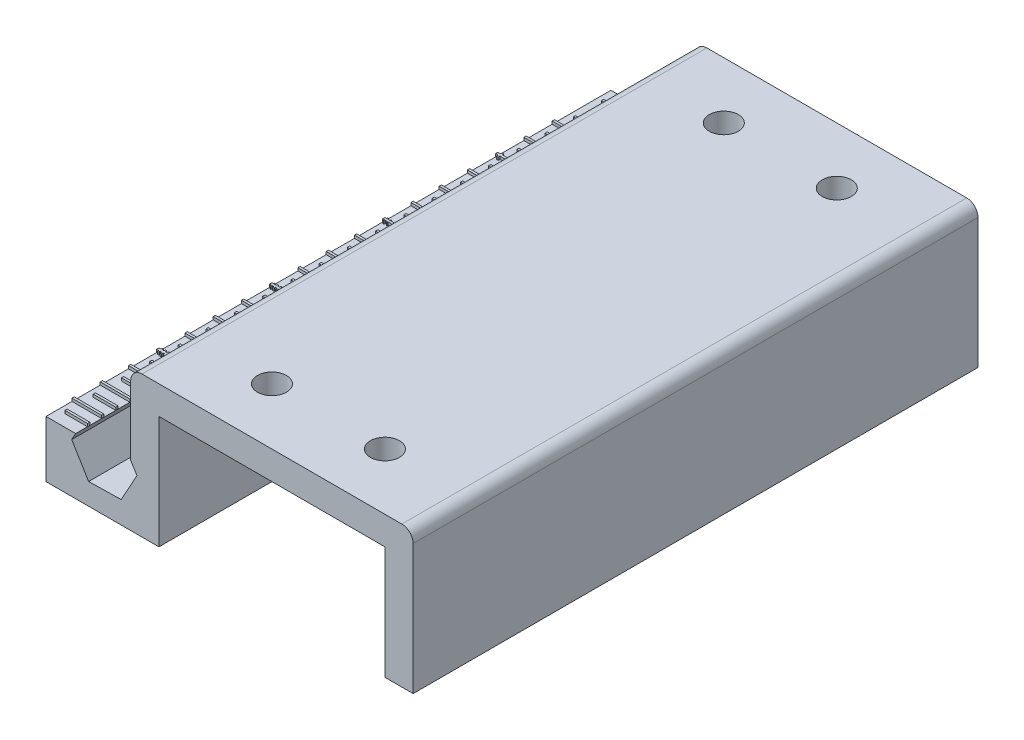
from build123d import *

# Parameters (mm, degrees)
BOSS_EXTRUDE2_DEPTH = 127
THE_RULER_W         = 6.669403244
THE_RULER_H         = 0.508
THE_RULER_W_2       = 5.08
BOSS_EXTRUDE6_DEPTH = 13.335
CUT_EXTRUDE1_DEPTH  = 127
SKETCH10_R          = 3.2639
CUT_EXTRUDE2_DEPTH  = 143.839717866


with BuildPart() as part:
    # Sketch1 → Boss-Extrude2 (new body)
    with BuildSketch(Plane.XY):
        with BuildLine():
            Line((50.8, 0), (57.15, 0))
            Line((57.15, 0), (57.15, 29.21))
            ThreePointArc((57.15, 29.21), (56.406051224, 31.006051224), (54.61, 31.75))
            Line((54.61, 31.75), (-3.81, 31.75))
            ThreePointArc((-3.81, 31.75), (-5.606051224, 31.006051224), (-6.35, 29.21))
            Line((-6.35, 29.21), (-6.35, 13.696358937))
            Line((-6.35, 13.696358937), (-4.955326016, 11.392114963))
            Line((-4.955326016, 11.392114963), (-8.489396689, 4.967655623))
            Line((-8.489396689, 4.967655623), (-15.820177019, 4.816020934))
            Line((-15.820177019, 4.816020934), (-19.616886677, 11.088845586))
            Line((-19.616886677, 11.088845586), (-18.730596756, 12.7))
            Line((-18.730596756, 12.7), (-25.4, 12.7))
            Line((-25.4, 12.7), (-25.4, 0))
            Line((-25.4, 0), (0, 0))
            Line((0, 0), (0, 25.4))
            Line((0, 25.4), (50.8, 25.4))
            Line((50.8, 25.4), (50.8, 0))
        make_face()
    extrude(amount=BOSS_EXTRUDE2_DEPTH)

    # THE RULER → Boss-Extrude6 (add)
    with BuildSketch(Plane(origin=(0, 0, 0), x_dir=(1, 0, 0), z_dir=(0, 1, 0))):
        with Locations((-22.065298378, -12.954)):
            Rectangle(THE_RULER_W, THE_RULER_H)
        with Locations((-22.065298378, -19.304)):
            Rectangle(THE_RULER_W, THE_RULER_H)
        Polygon((-18.730596756, -25.4), (-24.423685308, -25.4), (-24.423685308, -25.062958071), (-24.805558384, -25.062958071), (-24.805558384, -25.4), (-25.4, -25.4), (-25.4, -25.908), (-24.805558384, -25.908), (-24.805558384, -26.314653152), (-24.423685308, -26.314653152), (-24.423685308, -25.908), (-18.730596756, -25.908), align=None)
        with Locations((-22.065298378, -32.004)):
            Rectangle(THE_RULER_W, THE_RULER_H)
        Polygon((-24.29736963, -50.8), (-24.805558384, -50.8), (-24.805558384, -50.547467514), (-25.034254998, -50.547467514), (-25.034254998, -50.8), (-25.4, -50.8), (-25.4, -51.308), (-25.034254998, -51.308), (-25.034254998, -51.584005443), (-24.805558384, -51.584005443), (-24.805558384, -51.308), (-24.29736963, -51.308), (-24.29736963, -51.584005443), (-24.153376967, -51.584005443), (-24.153376967, -51.308), (-18.730596756, -51.308), (-18.730596756, -50.8), (-24.153376967, -50.8), (-24.153376967, -50.531005937), (-24.29736963, -50.531005937), align=None)
        with Locations((-22.065298378, -38.354)):
            Rectangle(THE_RULER_W, THE_RULER_H)
        with Locations((-22.065298378, -44.704)):
            Rectangle(THE_RULER_W, THE_RULER_H)
        Polygon((-24.423685308, -76.2), (-24.805558384, -76.2), (-24.805558384, -75.975694542), (-25.034254998, -75.975694542), (-25.034254998, -76.2), (-25.4, -76.2), (-25.4, -76.708), (-25.034254998, -76.708), (-25.034254998, -76.994970777), (-24.805558384, -76.994970777), (-24.805558384, -76.708), (-24.423685308, -76.708), (-24.423685308, -76.994970777), (-24.153376967, -76.994970777), (-24.153376967, -76.708), (-23.70340887, -76.708), (-23.70340887, -76.994970777), (-23.426490036, -76.994970777), (-23.426490036, -76.708), (-18.730596756, -76.708), (-18.730596756, -76.2), (-23.426490036, -76.2), (-23.426490036, -75.918827503), (-23.70340887, -75.918827503), (-23.70340887, -76.2), (-24.153376967, -76.2), (-24.153376967, -75.955015619), (-24.423685308, -75.955015619), align=None)
        with Locations((-22.065298378, -57.404)):
            Rectangle(THE_RULER_W, THE_RULER_H)
        with Locations((-22.065298378, -63.754)):
            Rectangle(THE_RULER_W, THE_RULER_H)
        with Locations((-22.065298378, -70.104)):
            Rectangle(THE_RULER_W, THE_RULER_H)
        Polygon((-18.730596756, -101.6), (-22.46829669, -101.6), (-22.46829669, -101.264555756), (-22.801754068, -101.264555756), (-22.801754068, -101.6), (-23.208268705, -101.6), (-23.208268705, -101.247593904), (-23.588496513, -101.247593904), (-23.588496513, -101.6), (-23.986830406, -101.6), (-23.986830406, -101.281517608), (-24.29736963, -101.281517608), (-24.29736963, -101.6), (-24.647702548, -101.6), (-24.647702548, -101.281517608), (-24.937399925, -101.281517608), (-24.937399925, -101.6), (-25.4, -101.6), (-25.4, -102.108), (-24.937399925, -102.108), (-24.937399925, -102.393984646), (-24.647702548, -102.393984646), (-24.647702548, -102.108), (-24.29736963, -102.108), (-24.29736963, -102.475462033), (-23.986830406, -102.475462033), (-23.986830406, -102.108), (-23.588496513, -102.108), (-23.588496513, -102.475462033), (-23.208268705, -102.475462033), (-23.208268705, -102.108), (-22.801754068, -102.108), (-22.801754068, -102.475462033), (-22.46829669, -102.475462033), (-22.46829669, -102.108), (-18.730596756, -102.108), align=None)
        with Locations((-22.065298378, -82.804)):
            Rectangle(THE_RULER_W, THE_RULER_H)
        with Locations((-22.065298378, -89.154)):
            Rectangle(THE_RULER_W, THE_RULER_H)
        with Locations((-22.065298378, -95.504)):
            Rectangle(THE_RULER_W, THE_RULER_H)
        with Locations((-22.065298378, -108.204)):
            Rectangle(THE_RULER_W, THE_RULER_H)
        with Locations((-22.065298378, -114.554)):
            Rectangle(THE_RULER_W, THE_RULER_H)
        with Locations((-22.065298378, -120.904)):
            Rectangle(THE_RULER_W, THE_RULER_H)
        with Locations((-21.270596756, -47.879)):
            Rectangle(THE_RULER_W_2, THE_RULER_H)
        with Locations((-21.270596756, -3.429)):
            Rectangle(THE_RULER_W_2, THE_RULER_H)
        with Locations((-21.270596756, -9.779)):
            Rectangle(THE_RULER_W_2, THE_RULER_H)
        with Locations((-21.270596756, -16.129)):
            Rectangle(THE_RULER_W_2, THE_RULER_H)
        with Locations((-21.270596756, -22.479)):
            Rectangle(THE_RULER_W_2, THE_RULER_H)
        with Locations((-21.270596756, -28.829)):
            Rectangle(THE_RULER_W_2, THE_RULER_H)
        with Locations((-21.270596756, -35.179)):
            Rectangle(THE_RULER_W_2, THE_RULER_H)
        with Locations((-21.270596756, -41.529)):
            Rectangle(THE_RULER_W_2, THE_RULER_H)
        with Locations((-21.270596756, -54.229)):
            Rectangle(THE_RULER_W_2, THE_RULER_H)
        with Locations((-21.270596756, -60.579)):
            Rectangle(THE_RULER_W_2, THE_RULER_H)
        with Locations((-21.270596756, -66.929)):
            Rectangle(THE_RULER_W_2, THE_RULER_H)
        with Locations((-21.270596756, -73.279)):
            Rectangle(THE_RULER_W_2, THE_RULER_H)
        with Locations((-21.270596756, -79.629)):
            Rectangle(THE_RULER_W_2, THE_RULER_H)
        with Locations((-21.270596756, -85.979)):
            Rectangle(THE_RULER_W_2, THE_RULER_H)
        with Locations((-21.270596756, -92.329)):
            Rectangle(THE_RULER_W_2, THE_RULER_H)
        with Locations((-21.270596756, -98.679)):
            Rectangle(THE_RULER_W_2, THE_RULER_H)
        with Locations((-21.270596756, -105.029)):
            Rectangle(THE_RULER_W_2, THE_RULER_H)
        with Locations((-21.270596756, -111.379)):
            Rectangle(THE_RULER_W_2, THE_RULER_H)
        with Locations((-21.270596756, -117.729)):
            Rectangle(THE_RULER_W_2, THE_RULER_H)
        with Locations((-21.270596756, -124.079)):
            Rectangle(THE_RULER_W_2, THE_RULER_H)
    extrude(amount=BOSS_EXTRUDE6_DEPTH)

    # Sketch9 → Cut-Extrude1 (cut)
    with BuildSketch(Plane.XY.offset(127)):
        Polygon((-4.955326016, 11.392114963), (-8.752035673, 17.664939614), (-16.082816004, 17.513304926), (-19.616886677, 11.088845586), (-15.820177019, 4.816020934), (-8.489396689, 4.967655623), align=None)
    extrude(amount=-CUT_EXTRUDE1_DEPTH, mode=Mode.SUBTRACT)

    # Sketch10 → Cut-Extrude2 (cut, through all)
    with BuildSketch(Plane(origin=(0, 31.75, 0), x_dir=(1, 0, 0), z_dir=(0, 1, 0))):
        with Locations((12.7, -12.7)):
            Circle(SKETCH10_R)
        with Locations((38.1, -12.7)):
            Circle(SKETCH10_R)
        with Locations((38.1, -114.3)):
            Circle(SKETCH10_R)
        with Locations((12.7, -114.3)):
            Circle(SKETCH10_R)
    extrude(amount=-CUT_EXTRUDE2_DEPTH, mode=Mode.SUBTRACT)


solid = part.part
